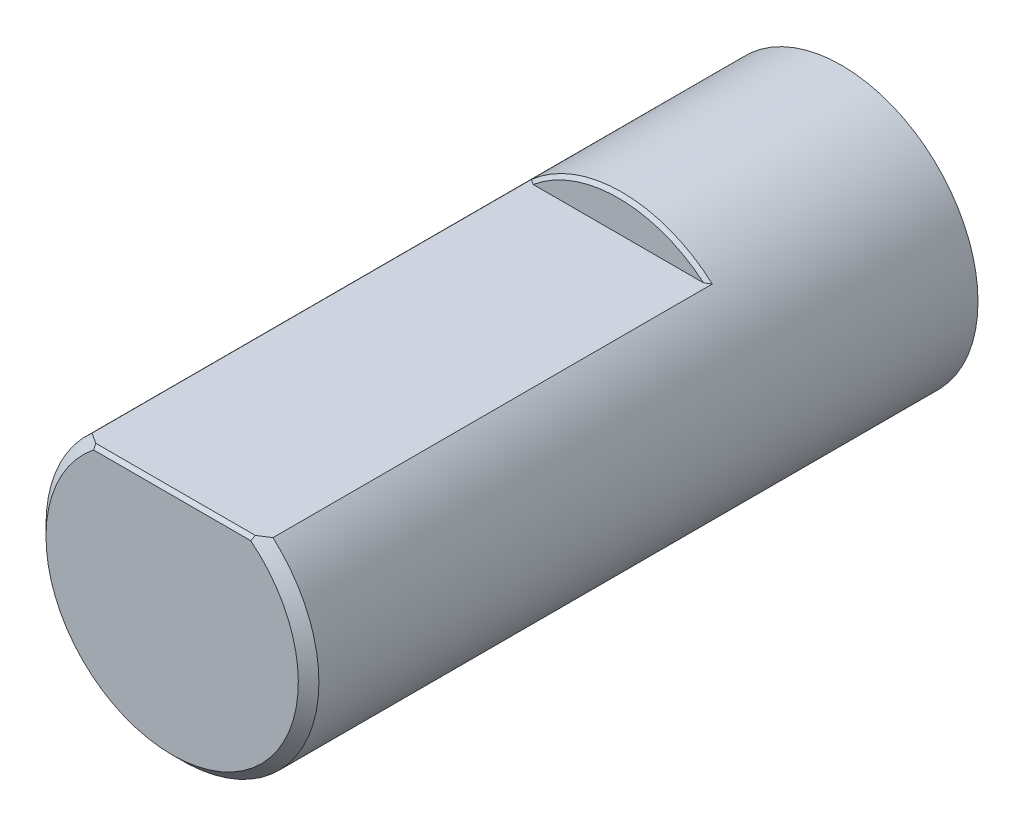
from build123d import *

# Parameters (mm, degrees)
EXTRUDE_1_DEPTH = 6.5
EXTRUDE_START   = 6.5
EXTRUDE_2_DEPTH = 13
CHAMFER_9_SIZE  = 0.1
CHAMFER_1_SIZE  = 0.3


with BuildPart() as part:
    # ｽｹｯﾁ1 → ﾎﾞｽ - 押し出し1 (new body)
    with BuildSketch(Plane.XY):
        with BuildLine():
            ThreePointArc((0, 3.975), (-1.409787218, 3.71660127), (-2.636285265, 2.975))
            Line((-2.636285265, 2.975), (0, 2.975))
            Line((0, 2.975), (0, 3.975))
        make_face()
        with BuildLine():
            Line((0, 2.975), (-2.636285265, 2.975))
            ThreePointArc((-2.636285265, 2.975), (-3.71660127, -1.409787218), (0, -3.975))
            Line((0, -3.975), (0, 2.975))
        make_face()
        with BuildLine():
            Line((0, 3.975), (0, 2.975))
            Line((0, 2.975), (2.636285265, 2.975))
            ThreePointArc((2.636285265, 2.975), (1.409787218, 3.71660127), (0, 3.975))
        make_face()
        with BuildLine():
            Line((2.636285265, 2.975), (0, 2.975))
            Line((0, 2.975), (0, -3.975))
            ThreePointArc((0, -3.975), (2.810749455, -2.810749455), (3.975, 0))
            ThreePointArc((3.975, 0), (3.624904063, 1.631163859), (2.636285265, 2.975))
        make_face()
    extrude(amount=EXTRUDE_1_DEPTH)

    # ｽｹｯﾁ1<3> → ﾎﾞｽ - 押し出し2 (add)
    with BuildSketch(Plane.XY.offset(EXTRUDE_START)):
        with BuildLine():
            ThreePointArc((-2.636285265, 2.975), (0, -3.975), (2.636285265, 2.975))
            Line((2.636285265, 2.975), (-2.636285265, 2.975))
        make_face()
    extrude(amount=EXTRUDE_2_DEPTH)

    # 面取り9
    # the kernel refuses this chamfer: 0.1 mm, written as the material it takes off along each edge
    with BuildSketch(Plane(origin=(0, 0, 6.5), x_dir=(-0.7102313336903862, 0.7039683605421307, 0), z_dir=(-0.7039683605421307, -0.7102313336903862, 0))) as chamfer_9_piece_1_section:
        Polygon((3.975, CHAMFER_9_SIZE), (3.975 - CHAMFER_9_SIZE, 0), (3.975, 0), align=None)
    chamfer_9_piece_1 = revolve(axis=Axis((0, 0, 6.5), (0, 0, -1)), revolution_arc=90.507480781, mode=Mode.PRIVATE)
    chamfer_9_piece_1 = split(chamfer_9_piece_1, bisect_by=Plane(origin=(0, 2.975, 6.452222293), z_dir=(0, 1, 0)), keep=Keep.TOP, mode=Mode.PRIVATE)
    add(chamfer_9_piece_1, mode=Mode.SUBTRACT)
    with BuildSketch(Plane(origin=(2.893453564, 2.975, 19.5), x_dir=(0, 0.02749587661058671, -0.9996219169112966), z_dir=(-1, 0, 0))) as chamfer_9_piece_2:
        Polygon((CHAMFER_9_SIZE * 0.999621916911, CHAMFER_9_SIZE * 0.0274958766106), (-CHAMFER_9_SIZE * 0.0274958766106, CHAMFER_9_SIZE * 0.999621916911), (0, 0), align=None)
    extrude(amount=5.786907128, mode=Mode.SUBTRACT)

    # 面取り1
    chamfer_1_edges = [part.edges().sort_by_distance(p)[0] for p in [
        (0, -3.975, 19.5),
    ]]
    chamfer(chamfer_1_edges, length=CHAMFER_1_SIZE)


solid = part.part
